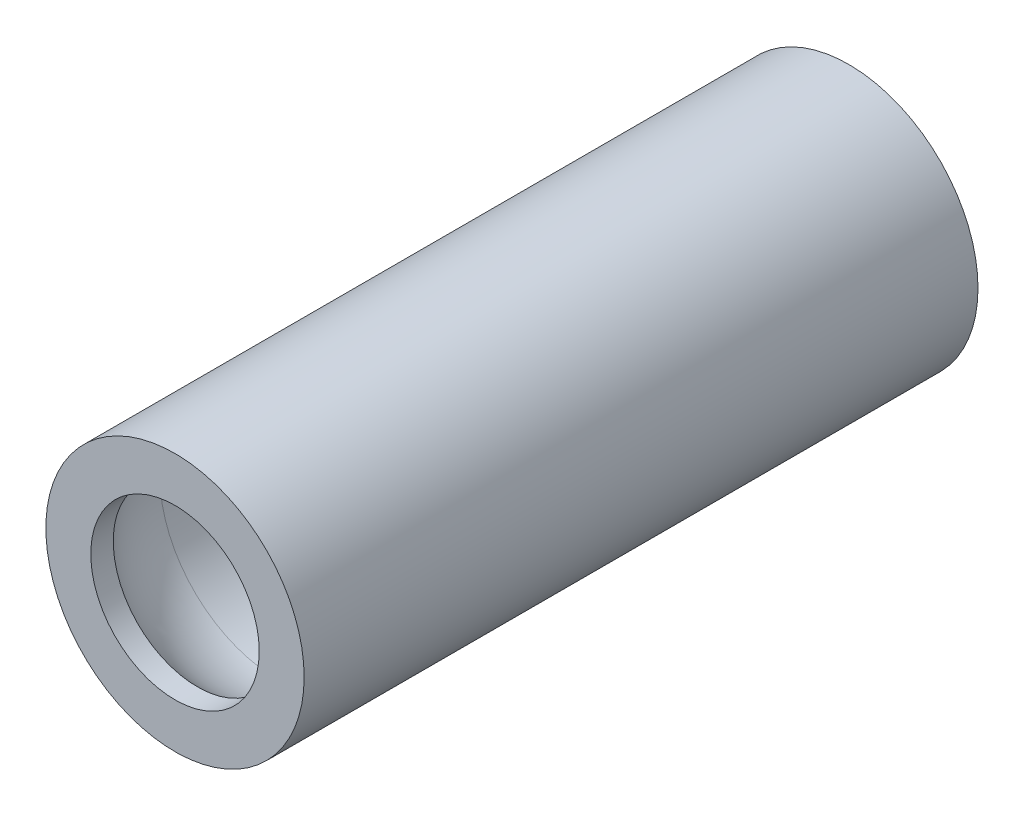
from build123d import *

# Parameters (mm, degrees)
SKETCH1_R           = 11.5
SKETCH1_R_2         = 10.5
BOSS_EXTRUDE1_DEPTH = 60
SKETCH1_3_R         = 10.5
SKETCH1_3_R_2       = 7.5
BOSS_EXTRUDE2_DEPTH = 2
FILLET2_R           = 10


with BuildPart() as part:
    # Sketch1 → Boss-Extrude1 (new body)
    with BuildSketch(Plane.XY):
        Circle(SKETCH1_R)
        Circle(SKETCH1_R_2, mode=Mode.SUBTRACT)
    extrude(amount=BOSS_EXTRUDE1_DEPTH)

    # Sketch1<3> → Boss-Extrude2 (add)
    with BuildSketch(Plane.XY):
        Circle(SKETCH1_3_R)
        Circle(SKETCH1_3_R_2, mode=Mode.SUBTRACT)
    boss_extrude2 = extrude(amount=BOSS_EXTRUDE2_DEPTH)

    # Mirror1: Boss-Extrude2 across plane
    add(boss_extrude2.mirror(Plane.XY.offset(30)))

    # Fillet2
    # the kernel refuses this fillet: 10 mm, written as the material it adds along each edge
    with BuildSketch(Plane(origin=(0, 0, 58), x_dir=(1, 0, 0), z_dir=(0, -1, 0))) as fillet2_piece_1:
        with BuildLine():
            CenterArc((0.5, -7.141428429), FILLET2_R, 0, 45.572995999)
            Line((7.5, 0), (7.64, 0.142828569))
            ThreePointArc((7.64, 0.142828569), (9, 0.2), (10.5, 0.2))
            Line((10.5, 0.2), (10.7, 0))
            Line((10.7, 0), (10.7, -7.141428429))
            Line((10.7, -7.141428429), (10.5, -7.141428429))
        make_face()
    revolve(axis=Axis((0, 0, 58), (0, 0, 1)))
    with BuildSketch(Plane(origin=(0, 0, 2), x_dir=(1, 0, 0), z_dir=(0, -1, 0))) as fillet2_piece_2:
        with BuildLine():
            CenterArc((0.5, 7.141428429), FILLET2_R, 314.427004001, 45.572995999)
            Line((10.5, 7.141428429), (10.7, 7.141428429))
            Line((10.7, 7.141428429), (10.7, 0))
            Line((10.7, 0), (10.5, -0.2))
            ThreePointArc((10.5, -0.2), (9, -0.2), (7.64, -0.142828569))
            Line((7.64, -0.142828569), (7.5, 0))
        make_face()
    revolve(axis=Axis((0, 0, 2), (0, 0, 1)))


solid = part.part
